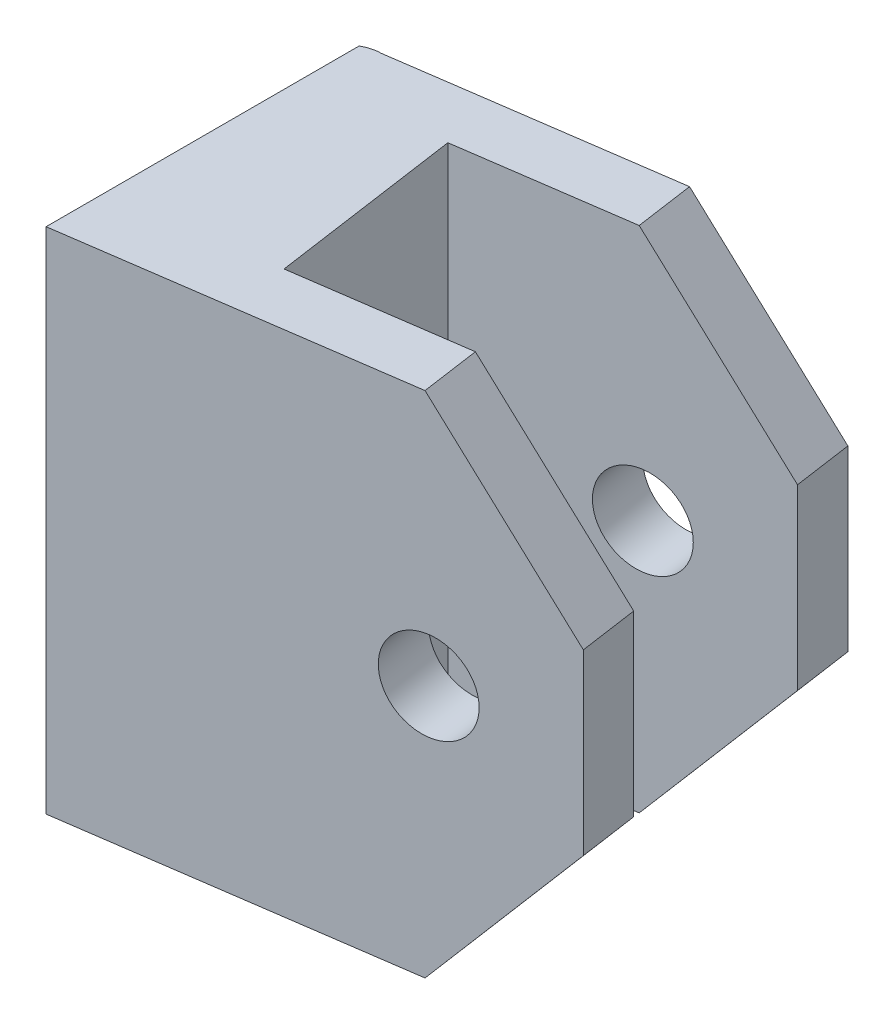
from build123d import *

# Parameters (mm, degrees)
BOSS_EXTRUDE1_DEPTH       = 54.37886
SKETCH6_R                 = 4.7625
CUT_EXTRUDE2_DEPTH        = 80.985513879
M8X1_0_TAPPED_HOLE1_D     = 7
M8X1_0_TAPPED_HOLE1_DEPTH = 13.896981233
M8X1_0_TAPPED_HOLE1_TIP   = 2.103012167


with BuildPart() as part:
    # Sketch1 → Boss-Extrude1 (new body)
    with BuildSketch(Plane(origin=(0, 0, 0), x_dir=(1, 0, 0), z_dir=(0, 1, 0))):
        with BuildLine():
            Line((43.576744561, 6.252203323), (0, 0))
            ThreePointArc((0, 0), (-0.986664618, -0.130963569), (-1.905, -0.514784687))
            Line((-1.905, -0.514784687), (-1.905, -33.845088532))
            Line((-1.905, -33.845088532), (-1.905, -33.965034078))
            Line((-1.905, -33.965034078), (-0.021561819, -33.694806493))
            Line((-0.021561819, -33.694806493), (48.313185262, -26.759945494))
            Line((48.313185262, -26.759945494), (47.411349637, -20.474311675))
            Line((47.411349637, -20.474311675), (14.726053779, -25.163856923))
            Line((14.726053779, -25.163856923), (11.793284327, -4.722975744))
            Line((11.793284327, -4.722975744), (44.478580186, -0.033430496))
            Line((44.478580186, -0.033430496), (43.576744561, 6.252203323))
        make_face()
    extrude(amount=BOSS_EXTRUDE1_DEPTH)

    # Sketch6 → Cut-Extrude2 (cut, through all)
    with BuildSketch(Plane(origin=(4.7364407, 0, 33.012148817), x_dir=(0.9898635935387781, 0, -0.1420213582053662), z_dir=(0.1420213582053662, 0, 0.9898635935387781))):
        with Locations((29.417979374, 27.18943)):
            Circle(SKETCH6_R)
        Polygon((44.022979374, 36.71443), (29.071940537, 54.37886), (44.022979374, 54.37886), align=None)
        Polygon((44.022979374, 0), (44.022979374, 17.66443), (29.071940537, 0), align=None)
    extrude(amount=-CUT_EXTRUDE2_DEPTH, mode=Mode.SUBTRACT)

    # M8x1.0 Tapped Hole1
    with Locations(Plane.ZY.offset(1.905)):
        with Locations((17.831658532, 14.48943), (17.831658532, 39.88943)):
            Hole(M8X1_0_TAPPED_HOLE1_D / 2, depth=M8X1_0_TAPPED_HOLE1_DEPTH)
            with Locations((0, 0, -(M8X1_0_TAPPED_HOLE1_DEPTH + M8X1_0_TAPPED_HOLE1_TIP / 2))):  # 118° drill point
                Cone(0, M8X1_0_TAPPED_HOLE1_D / 2, M8X1_0_TAPPED_HOLE1_TIP, mode=Mode.SUBTRACT)


solid = part.part
